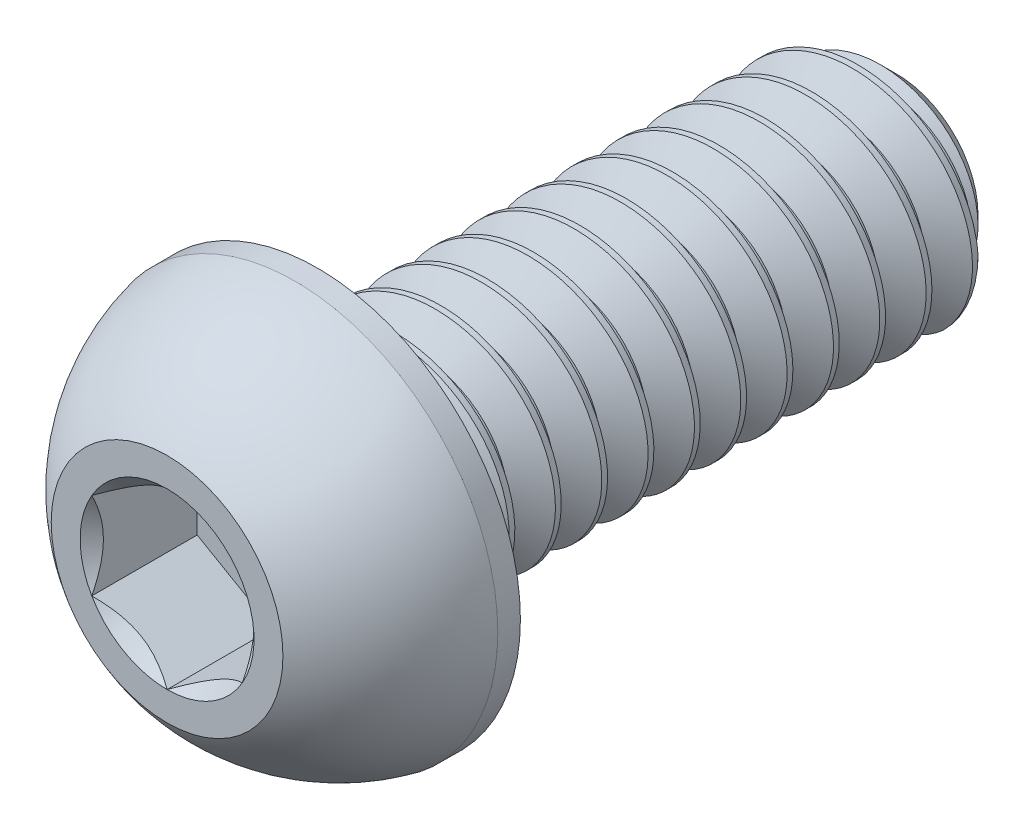
from build123d import *

# Parameters (mm, degrees)
CUT_EXTRUDE2_DEPTH = 0.91
CUT_SWEEP2_PITCH   = 0.4
CUT_SWEEP2_TO      = 5


with BuildPart() as part:
    # Sketch10 → Revolve3 (revolve)
    with BuildSketch(Plane(origin=(0, 0, 0), x_dir=(0, 0, -1), z_dir=(1, 0, 0)), mode=Mode.PRIVATE) as revolve3_sk:
        Polygon((6, 1), (6.3, 0.7), (6.3, 0), (1.3, 0), (1.3, 1), align=None)
    revolve(revolve3_sk.sketch.rotate(Axis((0, 0, 0), (0, 0, -1)), 90), axis=Axis((0, 0, 0), (0, 0, -1)))

    # Sketch7 → Revolve2 (revolve)
    with BuildSketch(Plane(origin=(0, 0, 0), x_dir=(0, 0, -1), z_dir=(1, 0, 0)), mode=Mode.PRIVATE) as revolve2_sk:
        with BuildLine():
            Line((1.105, 1.75), (1.3, 1.75))
            Line((1.3, 1.75), (1.3, 0))
            Line((1.3, 0), (0, 0))
            Line((0, 0), (0, 1))
            ThreePointArc((0, 1), (0.479976957, 1.481850617), (1.105, 1.75))
        make_face()
    revolve(revolve2_sk.sketch.rotate(Axis((0, 0, 0), (0, 0, -1)), 180), axis=Axis((0, 0, 0), (0, 0, -1)))

    # Sketch5 → Cut-Extrude2 (cut)
    with BuildSketch(Plane.XY):
        Polygon((0.65, -0.375277675), (0.65, 0.375277675), (0, 0.75055535), (-0.65, 0.375277675), (-0.65, -0.375277675), (0, -0.75055535), align=None)
    extrude(amount=-CUT_EXTRUDE2_DEPTH, mode=Mode.SUBTRACT)

    # Cut-Extrude3 cone 1 section (through the dimple's axis) → Cut-Extrude3 (revolve, cut)
    with BuildSketch(Plane(origin=(0, 0, 0), x_dir=(0, -1, 0), z_dir=(1, 0, 0))):
        Polygon((0, 0), (0.75055535, 0), (0, 0.75055535), align=None)
    revolve(axis=Axis((0, 0, 0), (0, 0, -1)), mode=Mode.SUBTRACT)


with BuildPart() as body_2:
    # Split1: read off the stored shape, not the designer's step
    # Split1: the piece on the far side of the plane
    add(part.part)
    split(bisect_by=Plane.XY.offset(-1.3), keep=Keep.BOTTOM)

    # Cut-Sweep2: arcs per turn and ends read off the stored shape
    # Cut-Sweep2: the profile of Sketch12 screwed along a right-hand helix through 16.666667 turns, 6 arcs to a turn; built about Z, then put on its axis
    cut_sweep2_z = Axis((0, 0, 0), (0, 0, 1))
    cut_sweep2_corners = [(0.740192379, 0, -0.15), (0.740192379, 0, -0.2), (1.021650635, 0, -0.3625), (1.021650635, 0, 0.0125)]
    with BuildLine(mode=Mode.PRIVATE) as cut_sweep2_profile:
        Line(cut_sweep2_corners[0], cut_sweep2_corners[1])
        Line(cut_sweep2_corners[1], cut_sweep2_corners[2])
        Line(cut_sweep2_corners[2], cut_sweep2_corners[3])
        Line(cut_sweep2_corners[3], cut_sweep2_corners[0])
    cut_sweep2_cap = Face(cut_sweep2_profile.wire())
    cut_sweep2_turn_angles = [0, 30, 60, 90, 120, 150, 180, 210, 240, 270, 300, 330, 360]
    cut_sweep2_turn_weights = [1, 0.8660254037844387, 1, 0.8660254037844387, 1, 0.8660254037844387, 1, 0.8660254037844387, 1, 0.8660254037844387, 1, 0.8660254037844387, 1]
    cut_sweep2_turn_rails = [Edge.make_bspline([Vector(p[0], p[1], 0).rotate(cut_sweep2_z, cut_sweep2_turn_angles[k]) / cut_sweep2_turn_weights[k] + Vector(0, 0, p[2] + CUT_SWEEP2_PITCH * cut_sweep2_turn_angles[k] / 360) for k in range(13)], [0, 0, 0, 1, 1, 2, 2, 3, 3, 4, 4, 5, 5, 6, 6, 6], 2, cut_sweep2_turn_weights) for p in cut_sweep2_corners]
    cut_sweep2_turn_sides = [Face.make_surface_from_curves(cut_sweep2_turn_rails[p[0]], cut_sweep2_turn_rails[p[1]]) for p in [(0, 1), (1, 2), (2, 3), (3, 0)]]
    cut_sweep2_last_angles = [5760, 5790, 5820, 5850, 5880, 5910, 5940, 5970, 6000]
    cut_sweep2_last_weights = [1, 0.8660254037844387, 1, 0.8660254037844387, 1, 0.8660254037844387, 1, 0.8660254037844387, 1]
    cut_sweep2_last_rails = [Edge.make_bspline([Vector(p[0], p[1], 0).rotate(cut_sweep2_z, cut_sweep2_last_angles[k]) / cut_sweep2_last_weights[k] + Vector(0, 0, p[2] + CUT_SWEEP2_PITCH * cut_sweep2_last_angles[k] / 360) for k in range(9)], [0, 0, 0, 1, 1, 2, 2, 3, 3, 4, 4, 4], 2, cut_sweep2_last_weights) for p in cut_sweep2_corners]
    cut_sweep2_last_sides = [Face.make_surface_from_curves(cut_sweep2_last_rails[p[0]], cut_sweep2_last_rails[p[1]]) for p in [(0, 1), (1, 2), (2, 3), (3, 0)]]
    cut_sweep2 = Plane(origin=(0, 0, -6.3), x_dir=(0, 1, 0), z_dir=(0, 0, 1)) * split(Solid(Shell([*[p.moved(Location((0, 0, CUT_SWEEP2_PITCH * i))) for i in range(16) for p in cut_sweep2_turn_sides], *cut_sweep2_last_sides, cut_sweep2_cap, cut_sweep2_cap.rotate(cut_sweep2_z, 6000).moved(Location((0, 0, CUT_SWEEP2_PITCH * 6000 / 360)))])), bisect_by=Plane.XY.offset(CUT_SWEEP2_TO), keep=Keep.BOTTOM, mode=Mode.PRIVATE)
    add(cut_sweep2, mode=Mode.SUBTRACT)


with BuildPart() as part_1:
    add(part.part)

    # Split1
    split(bisect_by=Plane.XY.offset(-1.3), keep=Keep.TOP)

    add(body_2.part)  # Boss-Extrude1 merges body 2
    # Boss-Extrude1 cone 1 section (through the dimple's axis) → Boss-Extrude1 (revolve)
    with BuildSketch(Plane(origin=(0, 0, -1.3), x_dir=(0, -1, 0), z_dir=(1, 0, 0))):
        Polygon((0, 0), (1, 0), (0, 1), align=None)
    revolve(axis=Axis((0, 0, -1.3), (0, 0, -1)))


solid = part_1.part
